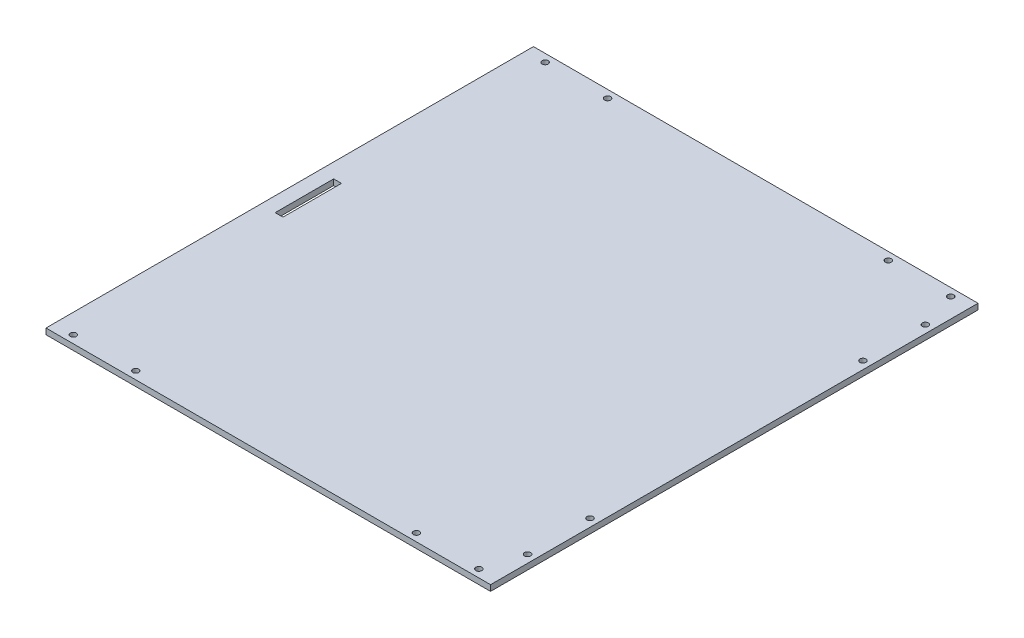
from build123d import *

# Parameters (mm, degrees)
SKETCH1_W           = 228
SKETCH1_H           = 250
SKETCH1_R           = 1.55
SKETCH1_W_2         = 4
SKETCH1_H_2         = 30
BOSS_EXTRUDE1_DEPTH = 3


with BuildPart() as part:
    # Sketch1 → Boss-Extrude1 (new body)
    with BuildSketch(Plane(origin=(0, 0, 0), x_dir=(1, 0, 0), z_dir=(0, 1, 0))):
        with Locations((114, 125)):
            Rectangle(SKETCH1_W, SKETCH1_H)
        with Locations((10, 4)):
            Circle(SKETCH1_R, mode=Mode.SUBTRACT)
        with Locations((42, 4)):
            Circle(SKETCH1_R, mode=Mode.SUBTRACT)
        with Locations((42, 246)):
            Circle(SKETCH1_R, mode=Mode.SUBTRACT)
        with Locations((10, 246)):
            Circle(SKETCH1_R, mode=Mode.SUBTRACT)
        with Locations((186, 4)):
            Circle(SKETCH1_R, mode=Mode.SUBTRACT)
        with Locations((218, 4)):
            Circle(SKETCH1_R, mode=Mode.SUBTRACT)
        with Locations((186, 246)):
            Circle(SKETCH1_R, mode=Mode.SUBTRACT)
        with Locations((218, 246)):
            Circle(SKETCH1_R, mode=Mode.SUBTRACT)
        with Locations((224, 23)):
            Circle(SKETCH1_R, mode=Mode.SUBTRACT)
        with Locations((224, 55)):
            Circle(SKETCH1_R, mode=Mode.SUBTRACT)
        with Locations((224, 227)):
            Circle(SKETCH1_R, mode=Mode.SUBTRACT)
        with Locations((224, 195)):
            Circle(SKETCH1_R, mode=Mode.SUBTRACT)
        with Locations((9.525, 125)):
            Rectangle(SKETCH1_W_2, SKETCH1_H_2, mode=Mode.SUBTRACT)
    extrude(amount=BOSS_EXTRUDE1_DEPTH)


solid = part.part
